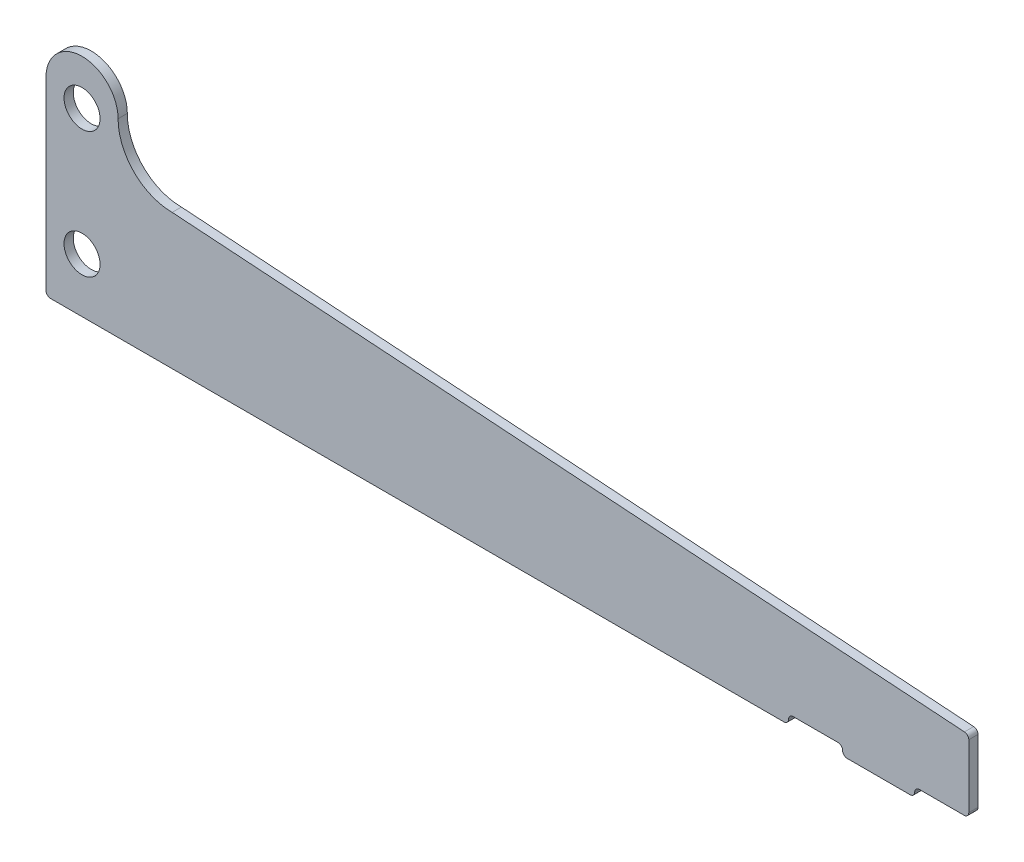
from build123d import *

# Parameters (mm, degrees)
SKETCH1_R           = 1.5875
BOSS_EXTRUDE1_DEPTH = 0.8128
FILLET1_R           = 0.4064


with BuildPart() as part:
    # Sketch1 → Boss-Extrude1 (new body)
    with BuildSketch(Plane.XY):
        with BuildLine():
            Line((0, -0.8128), (65.4074384, -0.8128))
            Line((65.4074384, -0.8128), (65.4074384, 0))
            Line((65.4074384, 0), (70.1699384, 0))
            Line((70.1699384, 0), (70.1699384, -0.8128))
            Line((70.1699384, -0.8128), (76.5199384, -0.8128))
            Line((76.5199384, -0.8128), (76.5199384, 0))
            Line((76.5199384, 0), (81.2824384, 0))
            Line((81.2824384, 0), (81.2824384, 6.35))
            Line((81.2824384, 6.35), (11.1125, 11.1125))
            ThreePointArc((11.1125, 11.1125), (7.744903955, 12.507403955), (6.35, 15.875))
            ThreePointArc((6.35, 15.875), (3.175, 19.05), (0, 15.875))
            Line((0, 15.875), (0, -0.8128))
        make_face()
        with Locations((3.175, 3.96875)):
            Circle(SKETCH1_R, mode=Mode.SUBTRACT)
        with Locations((3.175, 15.08125)):
            Circle(SKETCH1_R, mode=Mode.SUBTRACT)
    extrude(amount=BOSS_EXTRUDE1_DEPTH)

    # Fillet1
    fillet1_edges = [part.edges().sort_by_distance(p)[0] for p in [
        (81.2824384, 6.35, 0.4064),
        (81.2824384, 0, 0.4064),
        (76.5199384, 0, 0.4064),
        (76.5199384, -0.8128, 0.4064),
        (70.1699384, -0.8128, 0.4064),
        (70.1699384, 0, 0.4064),
        (65.4074384, 0, 0.4064),
        (65.4074384, -0.8128, 0.4064),
        (0, -0.8128, 0.4064),
    ]]
    fillet(fillet1_edges, radius=FILLET1_R - 0.0001)  # a hair under: the kernel refuses the full size


solid = part.part
